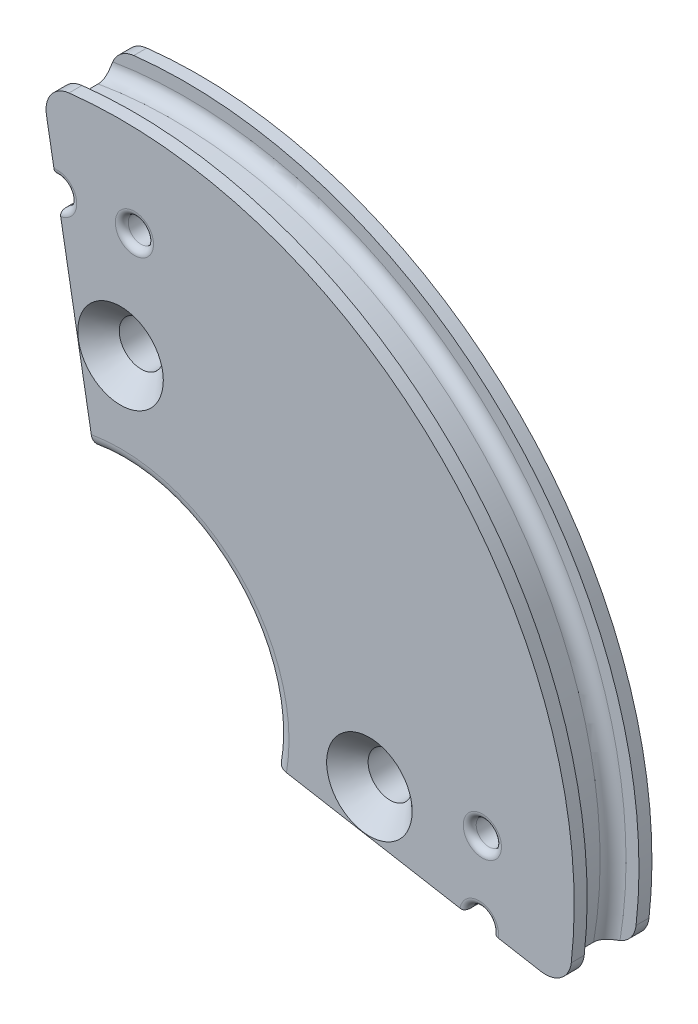
from build123d import *

# Parameters (mm, degrees)
SKETCH1_R               = 17
SKETCH1_R_2             = 0.85
SKETCH1_R_3             = 6
BOSS_EXTRUDE1_DEPTH     = 1.5
SKETCH7_W               = 0.5
SKETCH7_H               = 0.5
CUT_EXTRUDE1_DEPTH      = 25.794152536
CUT_EXTRUDE1_DEPTH_BACK = 25.794152536
CUT_EXTRUDE2_DEPTH      = 25.929901725
CUT_EXTRUDE2_DEPTH_BACK = 25.929901725
SKETCH5_R               = 0.5
SKETCH5_R_2             = 0.48729794
FILLET1_R               = 0.5
CHAMFER1_SIZE           = 0.8
FILLET2_R               = 1
FILLET3_R               = 0.25


with BuildPart() as part:
    # Sketch1 → Boss-Extrude1 (new, symmetric)
    with BuildSketch(Plane.XY):
        Circle(SKETCH1_R)
        with Locations((9.6, 0)):
            Circle(SKETCH1_R_2, mode=Mode.SUBTRACT)
        Circle(SKETCH1_R_3, mode=Mode.SUBTRACT)
        with Locations((0, -9.6)):
            Circle(SKETCH1_R_2, mode=Mode.SUBTRACT)
        with Locations((-9.6, 0)):
            Circle(SKETCH1_R_2, mode=Mode.SUBTRACT)
        with Locations((0, 9.6)):
            Circle(SKETCH1_R_2, mode=Mode.SUBTRACT)
    extrude(amount=BOSS_EXTRUDE1_DEPTH, both=True)

    # Sketch2 → Cut-Revolve1 (revolve, cut)
    with BuildSketch(Plane(origin=(0, 0, 0), x_dir=(1, 0, 0), z_dir=(0, 1, 0)), mode=Mode.PRIVATE) as cut_revolve1_sk:
        with BuildLine():
            Line((-16.5, -0.5), (-16.5, 0.5))
            ThreePointArc((-16.5, 0.5), (-16.646446609, 0.853553391), (-17, 1))
            Line((-17, 1), (-17, -1))
            ThreePointArc((-17, -1), (-16.646446609, -0.853553391), (-16.5, -0.5))
        make_face()
    revolve(cut_revolve1_sk.sketch.rotate(Axis((0, 0, 0), (0, 0, -1)), 180), axis=Axis((0, 0, 0), (0, 0, -1)), mode=Mode.SUBTRACT)

    # Sketch7 → Revolve1 (revolve)
    with BuildSketch(Plane(origin=(0, 0, 0), x_dir=(1, 0, 0), z_dir=(0, 1, 0))):
        with Locations((17.25, 1.25)):
            Rectangle(SKETCH7_W, SKETCH7_H)
        with Locations((17.25, -1.25)):
            Rectangle(SKETCH7_W, SKETCH7_H)
    revolve(axis=Axis((0, 0, 0), (0, 0, -1)))

    # Sketch4 → Cut-Extrude1 (cut, two sides: drawn at the far end of the back side and taken through both)
    with BuildSketch(Plane.XY.offset(-CUT_EXTRUDE1_DEPTH_BACK)):
        Polygon((-3.30899291, 18.766231333), (0, 0), (18.766231333, -3.30899291), (18.766231333, -21.784688157), (-24.932091475, -21.784688157), (-24.932091475, 18.766231333), align=None)
    extrude(amount=CUT_EXTRUDE1_DEPTH + CUT_EXTRUDE1_DEPTH_BACK, mode=Mode.SUBTRACT)

    # Sketch5 → Cut-Extrude2 (cut, two sides: drawn at the far end of the back side and taken through both)
    with BuildSketch(Plane.XY.offset(1.5).offset(-CUT_EXTRUDE2_DEPTH_BACK)):
        with Locations((-2.439480379, 13.834980723)):
            Circle(SKETCH5_R)
        with Locations((0.534729508, 13.957250241)):
            Circle(SKETCH5_R_2)
        with Locations((13.957250241, 0.534729508)):
            Circle(SKETCH5_R_2)
        with Locations((13.834980723, -2.439480379)):
            Circle(SKETCH5_R)
    extrude(amount=CUT_EXTRUDE2_DEPTH + CUT_EXTRUDE2_DEPTH_BACK, mode=Mode.SUBTRACT)

    # Fillet1
    fillet1_edges = [part.edges().sort_by_distance(p)[0] for p in [
        (4.242640687, 4.242640687, 1.5),
        (4.242640687, 4.242640687, -1.5),
    ]]
    fillet(fillet1_edges, radius=FILLET1_R)

    # Chamfer1
    chamfer1_edges = [part.edges().sort_by_distance(p)[0] for p in [
        (8.75, 0, 1.5),
        (-0.85, 9.6, 1.5),
    ]]
    chamfer(chamfer1_edges, length=CHAMFER1_SIZE)

    # Fillet2
    # the kernel refuses this fillet: 1 mm, written as the material it takes off along each edge
    with BuildSketch(Plane(origin=(17.234135678, -3.038843109, 4.15273452), x_dir=(0.1437119745897139, 0.9896195573853244, 0), z_dir=(0, 0, -1))) as fillet2_piece_1:
        with BuildLine():
            CenterArc((1.030776842, -0.999540335), FILLET2_R, 88.262699603, 93.474600793)
            Line((0.031236507, -1.029857301), (0, 0))
            ThreePointArc((0, 0), (0.530546904, 0.008044135), (1.061093808, 0))
        make_face()
    extrude(amount=5.805469041, mode=Mode.SUBTRACT)
    with BuildSketch(Plane(origin=(-3.038843109, 17.234135678, -4.15273452), x_dir=(0.17364817766692695, -0.9848077530122086, 0), z_dir=(0, 0, 1))) as fillet2_piece_2:
        with BuildLine():
            CenterArc((1.030330908, 1), FILLET2_R, 176.525399207, 93.474600793)
            ThreePointArc((0.032169145, 1.060606061), (0.008044135, 0.530546904), (0, 0))
            Line((0, 0), (1.030330908, 0))
        make_face()
    extrude(amount=5.805469041, mode=Mode.SUBTRACT)

    # Fillet3
    fillet3_edges = [part.edges().sort_by_distance(p)[0] for p in [
        (13.921804812, -1.947076503, -1.5),
        (13.921804812, -1.947076503, 1.5),
        (14.3273846, -2.526304468, 0),
        (13.342576847, -2.35265629, 0),
        (-2.35265629, 13.342576847, 0),
        (-2.526304468, 14.3273846, 0),
        (-1.947076503, 13.921804812, -1.5),
        (-1.947076503, 13.921804812, 1.5),
        (0.047431568, 13.957250241, 1.5),
        (0.047431568, 13.957250241, -1.5),
        (13.469952302, 0.534729508, 1.5),
        (13.469952302, 0.534729508, -1.5),
    ]]
    fillet(fillet3_edges, radius=FILLET3_R)


solid = part.part
